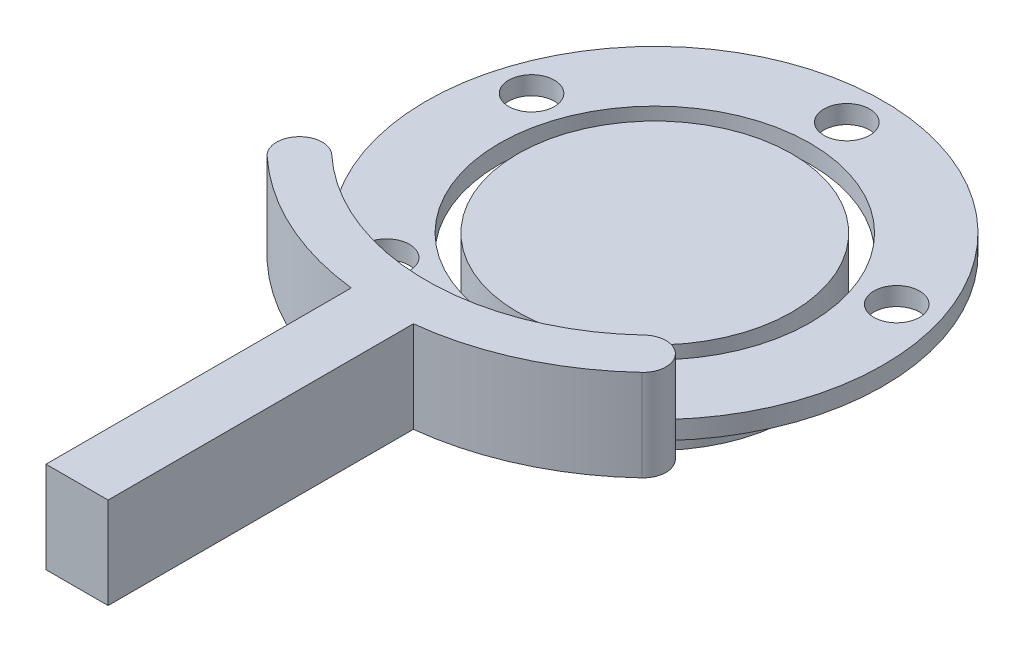
from build123d import *

# Parameters (mm, degrees)
SKETCH1_R           = 125
SKETCH1_R_2         = 85
BOSS_EXTRUDE1_DEPTH = 10
SKETCH2_R           = 12.5
CUT_EXTRUDE1_DEPTH  = 178.059312096
CIRPATTERN1_COUNT   = 5
SKETCH3_R           = 75
BOSS_EXTRUDE2_DEPTH = 50
BOSS_EXTRUDE3_DEPTH = 50


with BuildPart() as part:
    # Sketch1 → Boss-Extrude1 (new body)
    with BuildSketch(Plane(origin=(0, 0, 0), x_dir=(1, 0, 0), z_dir=(0, 1, 0))):
        with Locations(Location((0, 0, 0), (0, 0, 270))):
            Circle(SKETCH1_R)
        with Locations(Location((0, 0, 0), (0, 0, 270))):
            Circle(SKETCH1_R_2, mode=Mode.SUBTRACT)
    extrude(amount=BOSS_EXTRUDE1_DEPTH)

    # Sketch2 → Cut-Extrude1 (cut, through all)
    with BuildSketch(Plane(origin=(0, 10, 0), x_dir=(1, 0, 0), z_dir=(0, 1, 0))):
        with Locations(Location((0, 105, 0), (0, 0, 270))):
            Circle(SKETCH2_R)
    cut_extrude1 = extrude(amount=-CUT_EXTRUDE1_DEPTH, mode=Mode.SUBTRACT)

    # CirPattern1: Cut-Extrude1 ×5 about axis
    cirpattern1_axis = Axis((0, 0, 0), (0, 1, 0))
    for i in range(1, CIRPATTERN1_COUNT):
        add(cut_extrude1.rotate(cirpattern1_axis, i * 360 / CIRPATTERN1_COUNT), mode=Mode.SUBTRACT)


with BuildPart() as body_2:
    # Sketch3 → Boss-Extrude2 (new body)
    with BuildSketch(Plane(origin=(0, 200, 0), x_dir=(1, 0, 0), z_dir=(0, 1, 0))):
        with Locations(Location((-851.544942269, -20.84567913, 0), (0, 0, 270))):
            Circle(SKETCH3_R)
    extrude(amount=BOSS_EXTRUDE2_DEPTH)


with BuildPart() as body_2_1:
    # Body-Move/Copy1: read off the stored shape, not the designer's step
    # Body-Move/Copy1: moved
    add(body_2.part.moved(Location((851.5449423, -240, -20.8456791))))


with BuildPart() as body_3:
    # Sketch4 → Boss-Extrude3 (new body)
    with BuildSketch(Plane(origin=(0, 0, 0), x_dir=(1, 0, 0), z_dir=(0, 1, 0))):
        with BuildLine():
            Line((16.984547595, -546.986245961), (-16.984547595, -546.986245961))
            Line((-16.984547595, -546.986245961), (-16.984547595, -380.04655235))
            ThreePointArc((-16.984547595, -380.04655235), (-62.931363961, -367.171596509), (-102.50987753, -340.517972257))
            ThreePointArc((-102.50987753, -340.517972257), (-103.092948985, -322.849921213), (-85.424897941, -322.266849758))
            ThreePointArc((-85.424897941, -322.266849758), (0, -356.011237263), (85.424897941, -322.266849758))
            ThreePointArc((85.424897941, -322.266849758), (103.092948985, -322.849921213), (102.50987753, -340.517972257))
            ThreePointArc((102.50987753, -340.517972257), (62.931363961, -367.171596509), (16.984547595, -380.04655235))
            Line((16.984547595, -380.04655235), (16.984547595, -546.986245961))
        make_face()
    extrude(amount=BOSS_EXTRUDE3_DEPTH)


with BuildPart() as body_3_1:
    # Body-Move/Copy2: read off the stored shape, not the designer's step
    # Body-Move/Copy2: moved
    add(body_3.part.moved(Location((0, 0, -231.0112373))))

    # Combine2: union part
    add(part.part)


solid = Compound([body_2_1.part, body_3_1.part])
